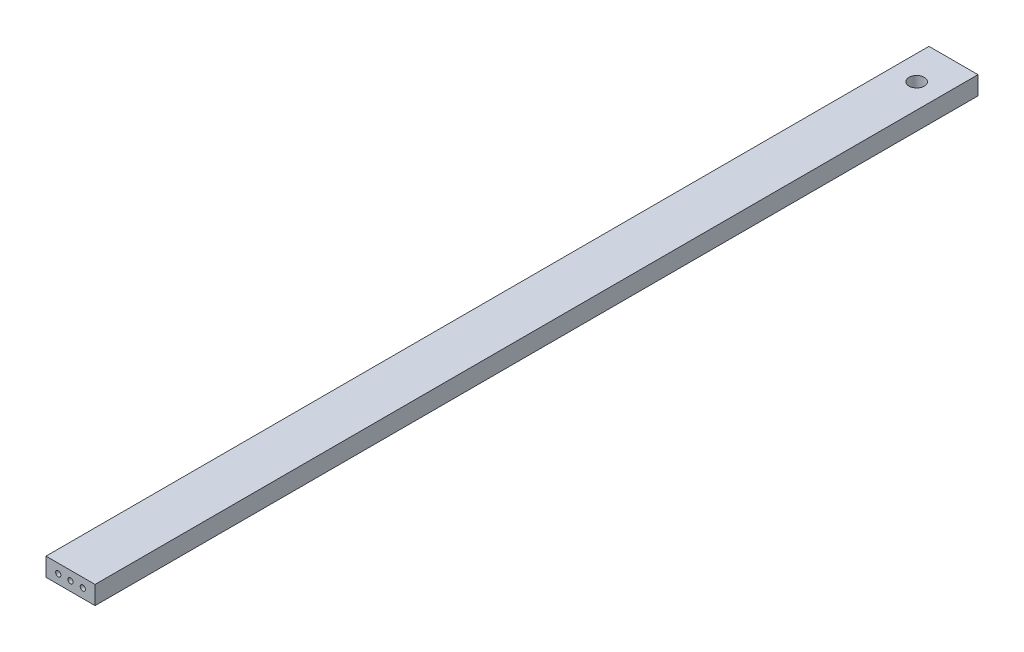
from build123d import *

# Parameters (mm, degrees)
SKETCH1_W                 = 25.4
SKETCH1_H                 = 457.2
SKETCH1_R                 = 3.96875
BOSS_EXTRUDE1_DEPTH       = 9.525
F_6_32_TAPPED_HOLE2_D     = 2.7051
F_6_32_TAPPED_HOLE2_DEPTH = 13.4874
F_6_32_TAPPED_HOLE2_TIP   = 0.81269403


with BuildPart() as part:
    # Sketch1 → Boss-Extrude1 (new body)
    with BuildSketch(Plane(origin=(0, 0, 0), x_dir=(1, 0, 0), z_dir=(0, 1, 0))):
        with Locations((0, -209.55)):
            Rectangle(SKETCH1_W, SKETCH1_H)
        Circle(SKETCH1_R, mode=Mode.SUBTRACT)
    extrude(amount=BOSS_EXTRUDE1_DEPTH)

    # #6-32 Tapped Hole2
    with Locations(Plane.XY.offset(438.15)):
        with Locations((-6.35, 4.7625), (0, 4.7625), (6.35, 4.7625)):
            Hole(F_6_32_TAPPED_HOLE2_D / 2, depth=F_6_32_TAPPED_HOLE2_DEPTH)
            with Locations((0, 0, -(F_6_32_TAPPED_HOLE2_DEPTH + F_6_32_TAPPED_HOLE2_TIP / 2))):  # 118° drill point
                Cone(0, F_6_32_TAPPED_HOLE2_D / 2, F_6_32_TAPPED_HOLE2_TIP, mode=Mode.SUBTRACT)


solid = part.part
